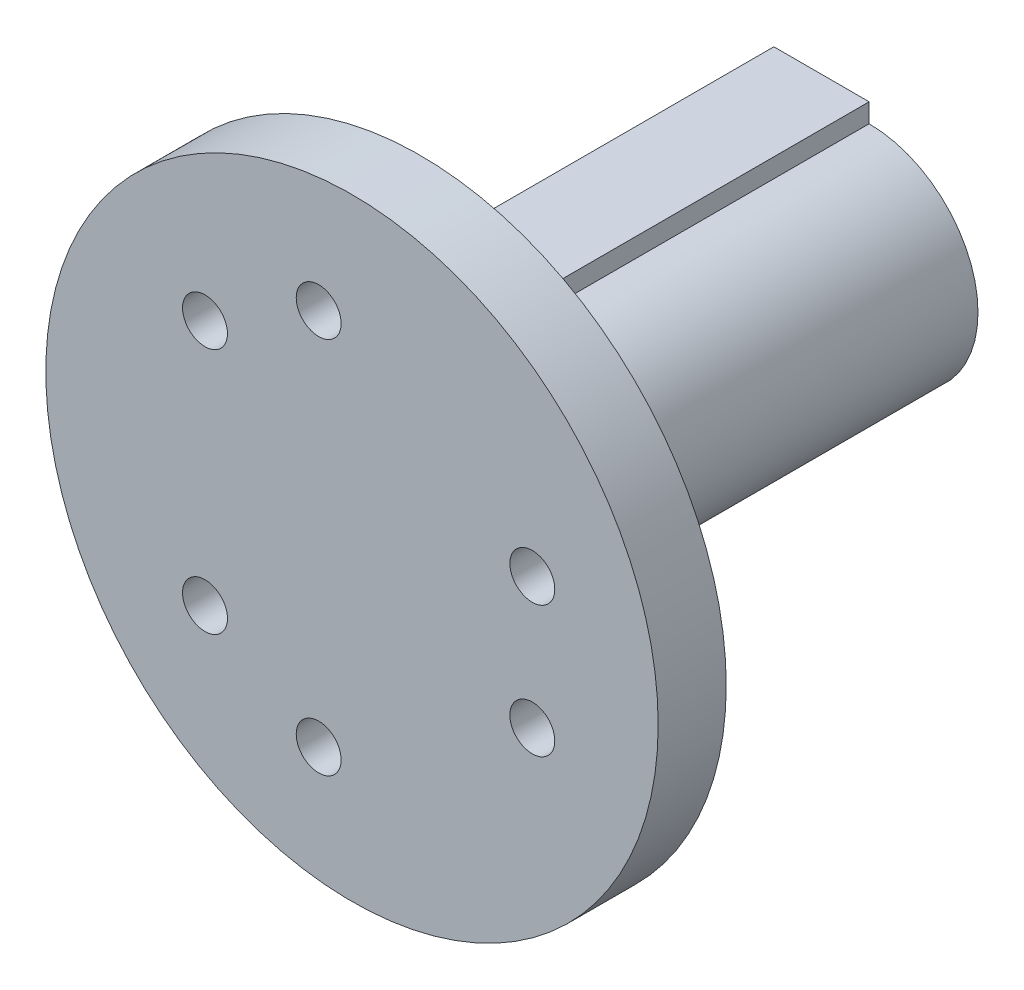
from build123d import *

# Parameters (mm, degrees)
SKETCH_1_R               = 22.5
SKETCH_1_R_2             = 1.65
EXTRUDE_1_DEPTH          = 5
SKETCH_3_R               = 3
CUT_EXTRUDE_1_DEPTH      = 2
SKETCH_11_R              = 8
EXTRUDE_2_DEPTH          = 25
CUT_EXTRUDE_9_DEPTH      = 25
CUT_EXTRUDE_9_DEPTH_BACK = 25
SKETCH_12_W              = 8
SKETCH_12_H              = 15
SKETCH_13_W              = 15
SKETCH_13_H              = 18.8
EXTRUDE_3_DEPTH          = 7
EXTRUDE_5_DEPTH          = 8
SKETCH_16_W              = 23
SKETCH_16_H              = 1.2
EXTRUDE_6_DEPTH          = 1


with BuildPart() as part:
    # 스케치1 → 보스-돌출1 (new body)
    with BuildSketch(Plane.XY):
        Circle(SKETCH_1_R)
        with Locations((-2.448439305, 13.885789317)):
            Circle(SKETCH_1_R_2, mode=Mode.SUBTRACT)
        with Locations((-10.801226648, 9.063305297)):
            Circle(SKETCH_1_R_2, mode=Mode.SUBTRACT)
        with Locations((13.249665953, 4.822484021)):
            Circle(SKETCH_1_R_2, mode=Mode.SUBTRACT)
        with Locations((13.249665953, -4.822484021)):
            Circle(SKETCH_1_R_2, mode=Mode.SUBTRACT)
        with Locations((-2.448439305, -13.885789317)):
            Circle(SKETCH_1_R_2, mode=Mode.SUBTRACT)
        with Locations((-10.801226648, -9.063305297)):
            Circle(SKETCH_1_R_2, mode=Mode.SUBTRACT)
    extrude(amount=EXTRUDE_1_DEPTH)

    # 스케치3 → 컷-돌출1 (cut)
    with BuildSketch(Plane(origin=(0, 0, 0), x_dir=(-1, 0, 0), z_dir=(0, 0, -1))):
        with Locations((2.448439305, 13.885789317)):
            Circle(SKETCH_3_R)
        with Locations((10.801226648, 9.063305297)):
            Circle(SKETCH_3_R)
        with Locations((10.801226648, -9.063305297)):
            Circle(SKETCH_3_R)
        with Locations((2.448439305, -13.885789317)):
            Circle(SKETCH_3_R)
        with Locations((-13.249665953, -4.822484021)):
            Circle(SKETCH_3_R)
        with Locations((-13.249665953, 4.822484021)):
            Circle(SKETCH_3_R)
    extrude(amount=-CUT_EXTRUDE_1_DEPTH, mode=Mode.SUBTRACT)

    # 스케치11 → 보스-돌출2 (add)
    with BuildSketch(Plane(origin=(0, 0, 0), x_dir=(-1, 0, 0), z_dir=(0, 0, -1))):
        Circle(SKETCH_11_R)
    extrude(amount=EXTRUDE_2_DEPTH)

    # 스케치12 → 컷-돌출9 (cut, two sides: drawn at the far end of the back side and taken through both)
    with BuildSketch(Plane(origin=(0, 0, 0), x_dir=(1, 0, 0), z_dir=(0, 1, 0)).offset(-CUT_EXTRUDE_9_DEPTH_BACK)):
        with Locations((-4, 17.5)):
            Rectangle(SKETCH_12_W, SKETCH_12_H)
    extrude(amount=CUT_EXTRUDE_9_DEPTH + CUT_EXTRUDE_9_DEPTH_BACK, mode=Mode.SUBTRACT)

    # 스케치13 → 보스-돌출3 (add)
    with BuildSketch(Plane.ZY):
        with Locations((-17.5, 0)):
            Rectangle(SKETCH_13_W, SKETCH_13_H)
    extrude(amount=EXTRUDE_3_DEPTH)

    # 스케치15 → 보스-돌출5 (add)
    with BuildSketch(Plane(origin=(0, 0, -25), x_dir=(-1, 0, 0), z_dir=(0, 0, -1))):
        with BuildLine():
            Line((0, 8), (0, 9.4))
            Line((0, 9.4), (7, 9.4))
            Line((7, 9.4), (7, -9.4))
            Line((7, -9.4), (0, -9.4))
            Line((0, -9.4), (0, -8))
            ThreePointArc((0, -8), (-8, 0), (0, 8))
        make_face()
    extrude(amount=EXTRUDE_5_DEPTH)

    # 스케치16 → 보스-돌출6 (add)
    with BuildSketch(Plane.ZY.offset(7)):
        with Locations((-21.5, 0)):
            Rectangle(SKETCH_16_W, SKETCH_16_H)
    extrude(amount=EXTRUDE_6_DEPTH)


solid = part.part
